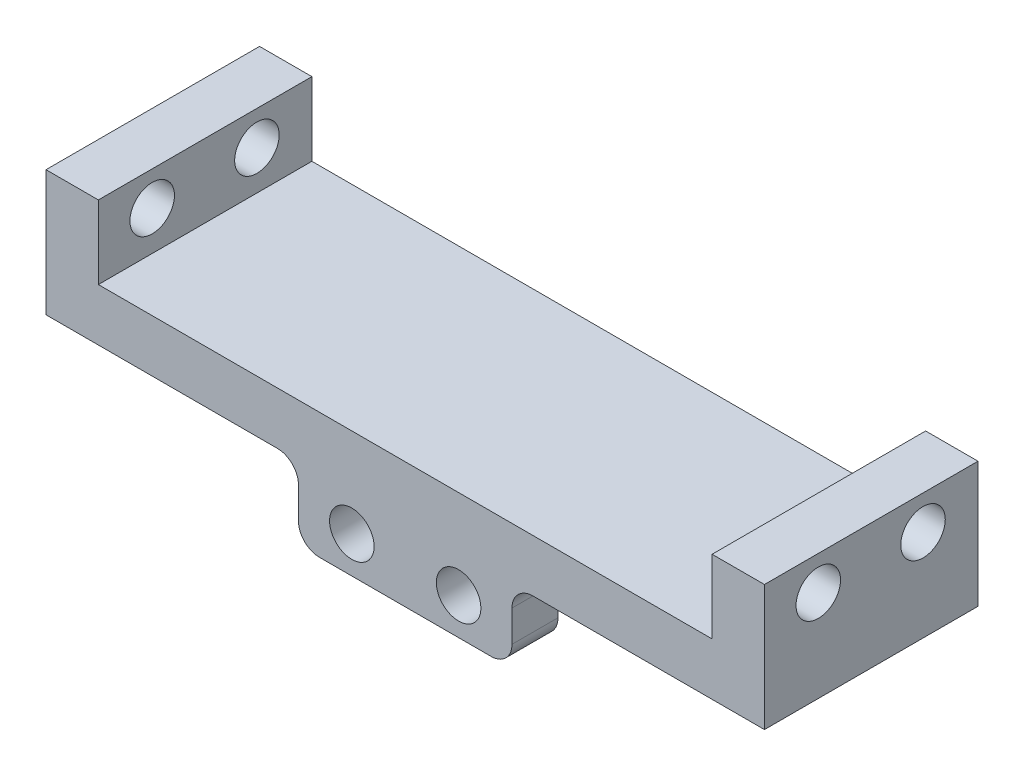
from build123d import *

# Parameters (mm, degrees)
SKETCH1_W                  = 68.6
SKETCH1_H                  = 20.38979341
BRACKETBASE_DEPTH          = 5
SKETCH2_W                  = 20.38979341
SKETCH2_H                  = 12
LEGMOUNTINGTAB_DEPTH       = 5
SKETCH3_R                  = 2.125
LEGMOUNTINGHOLES_DEPTH     = 5
SKETCH4_W                  = 20.38979341
SKETCH4_H                  = 7
ARDUINOMOUNTINGTAB_DEPTH   = 4.38979341
SKETCH5_R                  = 2.125
ARDUINOMOUNTINGHOLES_DEPTH = 5
FILLET1_R                  = 2


with BuildPart() as part:
    # Sketch1 → bracketBase (new body)
    with BuildSketch(Plane(origin=(0, 0, 0), x_dir=(1, 0, 0), z_dir=(0, 1, 0))):
        with Locations((34.3, 10.194896705)):
            Rectangle(SKETCH1_W, SKETCH1_H)
    extrude(amount=BRACKETBASE_DEPTH)

    # Sketch2 → legMountingTab (add)
    with BuildSketch(Plane.ZY):
        with Locations((-10.194896705, 6)):
            Rectangle(SKETCH2_W, SKETCH2_H)
    legmountingtab = extrude(amount=-LEGMOUNTINGTAB_DEPTH)

    # Sketch3 → legMountingHoles (cut)
    with BuildSketch(Plane(origin=(5, 0, 0), x_dir=(0, 0, -1), z_dir=(1, 0, 0))):
        with Locations((15.13979341, 8.75)):
            Circle(SKETCH3_R)
        with Locations((5.13979341, 8.75)):
            Circle(SKETCH3_R)
    legmountingholes = extrude(amount=-LEGMOUNTINGHOLES_DEPTH, mode=Mode.SUBTRACT)

    # legMountingHoles2: legMountingTab, legMountingHoles across plane
    add(legmountingtab.mirror(Plane.ZY.offset(-34.3)))
    add(legmountingholes.mirror(Plane.ZY.offset(-34.3)), mode=Mode.SUBTRACT)

    # Sketch4 → arduinoMountingTab (add)
    with BuildSketch(Plane.XY):
        with Locations((34.3, -3.5)):
            Rectangle(SKETCH4_W, SKETCH4_H)
    extrude(amount=-ARDUINOMOUNTINGTAB_DEPTH)

    # Sketch5 → arduinoMountingHoles (cut)
    with BuildSketch(Plane.XY):
        with Locations((39.397448352, -3.5)):
            Circle(SKETCH5_R)
        with Locations((29.202551647, -3.5)):
            Circle(SKETCH5_R)
    extrude(amount=-ARDUINOMOUNTINGHOLES_DEPTH, mode=Mode.SUBTRACT)

    # Fillet1
    fillet1_edges = [part.edges().sort_by_distance(p)[0] for p in [
        (24.105103295, -7, -2.194896705),
        (44.494896705, -7, -2.194896705),
        (44.494896705, 0, -2.194896705),
        (24.105103295, 0, -2.194896705),
    ]]
    fillet(fillet1_edges, radius=FILLET1_R)


solid = part.part
